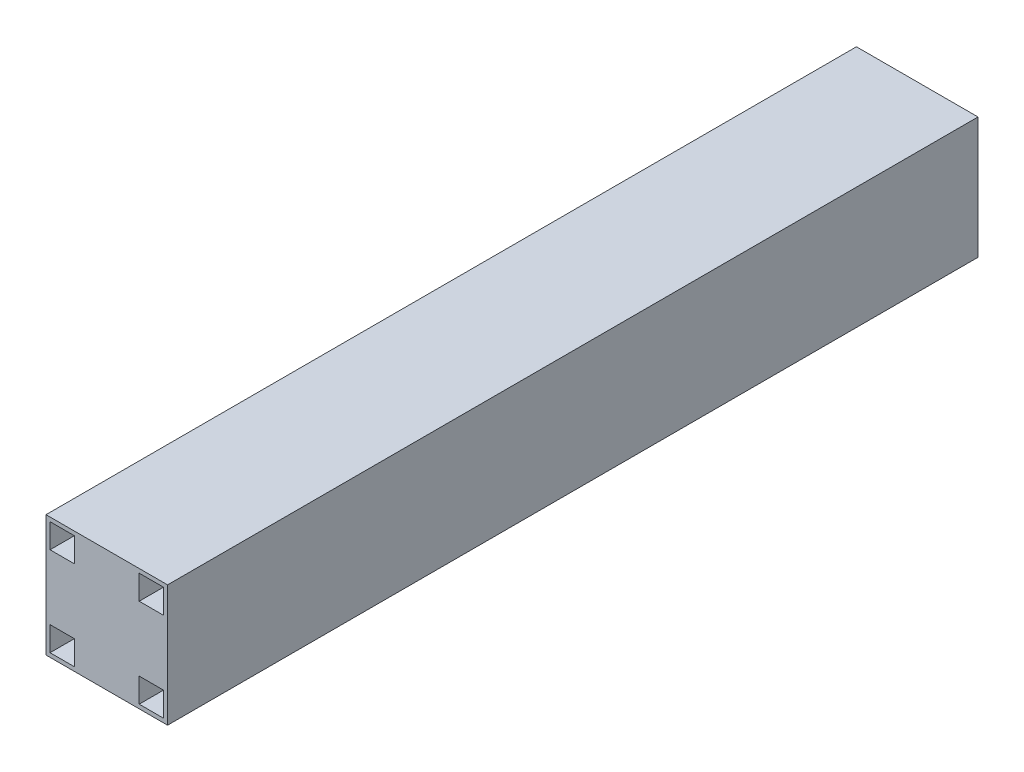
from build123d import *

# Parameters (mm, degrees)
SKETCH1_W           = 30
SKETCH1_H           = 30
BOSS_EXTRUDE1_DEPTH = 200
SKETCH2_W           = 6
SKETCH2_H           = 6
CUT_EXTRUDE1_DEPTH  = 200


with BuildPart() as part:
    # Sketch1 → Boss-Extrude1 (new body)
    with BuildSketch(Plane.XY):
        Rectangle(SKETCH1_W, SKETCH1_H)
    extrude(amount=BOSS_EXTRUDE1_DEPTH)

    # Sketch2 → Cut-Extrude1 (cut)
    with BuildSketch(Plane.XY.offset(200)):
        with Locations((11, 11)):
            Rectangle(SKETCH2_W, SKETCH2_H)
        with Locations((-11, 11)):
            Rectangle(SKETCH2_W, SKETCH2_H)
        with Locations((11, -11)):
            Rectangle(SKETCH2_W, SKETCH2_H)
        with Locations((-11, -11)):
            Rectangle(SKETCH2_W, SKETCH2_H)
    extrude(amount=-CUT_EXTRUDE1_DEPTH, mode=Mode.SUBTRACT)


solid = part.part
